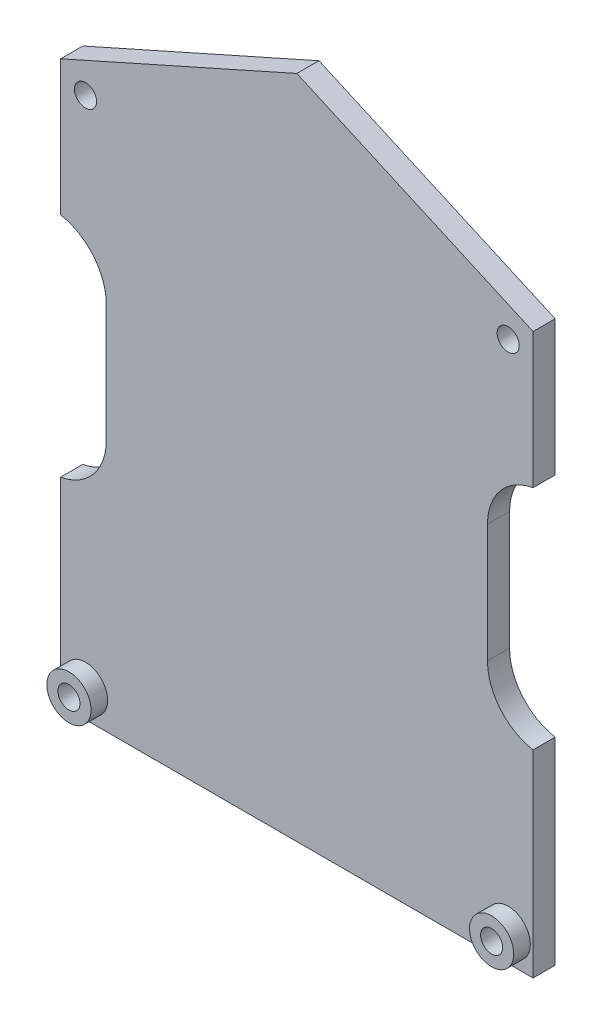
from build123d import *

# Parameters (mm, degrees)
SKETCH3_R           = 2
BOSS_EXTRUDE1_DEPTH = 4
FILLET1_R           = 10
SKETCH4_R           = 4
SKETCH4_R_2         = 2
BOSS_EXTRUDE2_DEPTH = 3


with BuildPart() as part:
    # Sketch3 → Boss-Extrude1 (new body)
    with BuildSketch(Plane.XY):
        Polygon((-42.75, 8.482081222), (-42.75, -16), (-34.5, -16), (-34.5, -57.1), (-42.75, -57.1), (-42.75, -92.85), (42.75, -92.85), (42.75, -57.1), (34.5, -57.1), (34.5, -16), (42.75, -16), (42.75, 8.482081222), (0, 27.552713192), align=None)
        with Locations((-38.25, 5)):
            Circle(SKETCH3_R, mode=Mode.SUBTRACT)
        with Locations((-38.25, -87.85)):
            Circle(SKETCH3_R, mode=Mode.SUBTRACT)
        with Locations(Location((38.25, -87.85, 0), (0, 0, 180))):
            Circle(SKETCH3_R, mode=Mode.SUBTRACT)
        with Locations(Location((38.25, 5, 0), (0, 0, 180))):
            Circle(SKETCH3_R, mode=Mode.SUBTRACT)
    extrude(amount=BOSS_EXTRUDE1_DEPTH)

    # Fillet1
    # the kernel refuses this fillet: 10 mm, written as the material it adds along each edge
    with BuildSketch(Plane(origin=(34.5, -57.1, 0), x_dir=(1, 0, 0), z_dir=(0, 0, 1)), Plane(origin=(-34.5, -16, 0), x_dir=(-1, 0, 0), z_dir=(0, 0, 1))) as fillet1_piece_1:
        with BuildLine():
            CenterArc((10, 9.845684334), FILLET1_R, 180, 79.921341892)
            Line((0, 9.845684334), (-0.2, 9.845684334))
            Line((-0.2, 9.845684334), (-0.2, 0))
            Line((-0.2, 0), (0, -0.2))
            ThreePointArc((0, -0.2), (4.125, -0.2), (8.215, -0.196913687))
            Line((8.215, -0.196913687), (8.25, 0))
        make_face()
    extrude(amount=4)
    with BuildSketch(Plane(origin=(34.5, -16, 0), x_dir=(0, -1, 0), z_dir=(0, 0, 1)), Plane(origin=(-34.5, -57.1, 0), x_dir=(0, 1, 0), z_dir=(0, 0, 1))) as fillet1_piece_2:
        with BuildLine():
            CenterArc((9.845684334, 10), FILLET1_R, 190.078658108, 79.921341892)
            Line((0, 8.25), (-0.196913687, 8.215))
            ThreePointArc((-0.196913687, 8.215), (-0.2, 4.125), (-0.2, 0))
            Line((-0.2, 0), (0, -0.2))
            Line((0, -0.2), (9.845684334, -0.2))
            Line((9.845684334, -0.2), (9.845684334, 0))
        make_face()
    extrude(amount=4)

    # Sketch4 → Boss-Extrude2 (add)
    # profile 1 of 2: a face of its own
    with BuildSketch(Plane.XY.offset(4)):
        with Locations(Location((38.25, -87.85, 0), (0, 0, 180))):
            Circle(SKETCH4_R)
        with Locations(Location((38.25, -87.85, 0), (0, 0, 180))):
            Circle(SKETCH4_R_2, mode=Mode.SUBTRACT)
    # profile 2 of 2: a face of its own
    with BuildSketch(Plane.XY.offset(4)):
        with Locations(Location((-38.25, -87.85, 0), (0, 0, 180))):
            Circle(SKETCH4_R)
        with Locations((-38.25, -87.85)):
            Circle(SKETCH4_R_2, mode=Mode.SUBTRACT)
    extrude(amount=BOSS_EXTRUDE2_DEPTH)


solid = part.part
